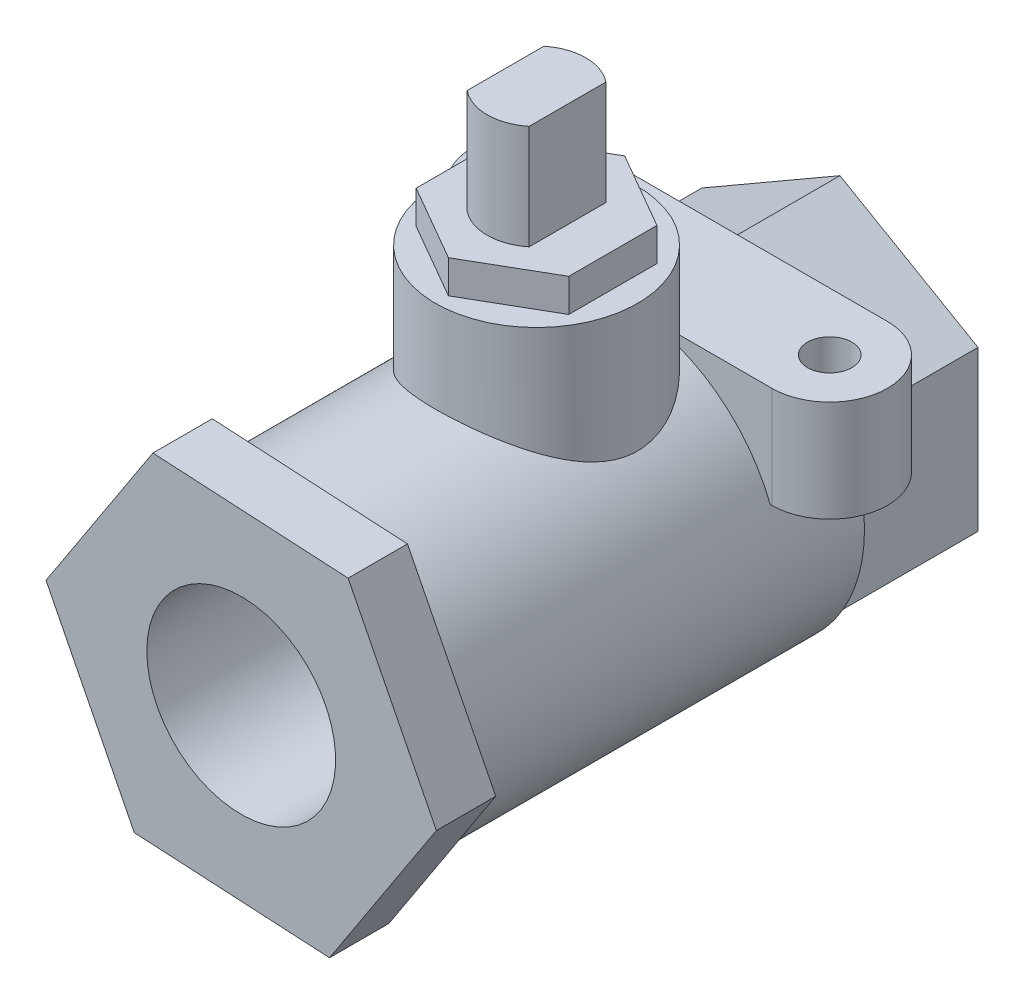
from build123d import *

# Parameters (mm, degrees)
SKETCH1_R                = 15.0114
BOSS_EXTRUDE1_DEPTH      = 38.1
BOSS_EXTRUDE2_DEPTH      = 5.588
BOSS_EXTRUDE3_DEPTH      = 12.7
BOSS_EXTRUDE4_DEPTH      = 9.5504
SKETCH4_R                = 8.89
CUT_EXTRUDE1_DEPTH       = 62.91098247
BOSS_EXTRUDE5_DEPTH      = 8.636
BOSS_EXTRUDE5_DEPTH_BACK = 5.08
SKETCH6_R                = 9.525
BOSS_EXTRUDE6_DEPTH      = 3.1115
BOSS_EXTRUDE7_DEPTH      = 9.8298
SKETCH9_R                = 2.08915
CUT_EXTRUDE2_DEPTH       = 8.89


with BuildPart() as part:
    # Sketch1 → Boss-Extrude1 (new body)
    with BuildSketch(Plane.XY):
        Circle(SKETCH1_R)
    extrude(amount=BOSS_EXTRUDE1_DEPTH)

    # Sketch2 → Boss-Extrude2 (add)
    with BuildSketch(Plane.XY.offset(38.1)):
        Polygon((-8.314485622, 16.42722286), (-18.383635121, 1.013055662), (-10.069149499, -15.414167198), (8.314485622, -16.42722286), (18.383635121, -1.013055662), (10.069149499, 15.414167198), align=None)
    extrude(amount=BOSS_EXTRUDE2_DEPTH)

    # Sketch3 → Boss-Extrude3 (add)
    with BuildSketch(Plane(origin=(0, 0, 0), x_dir=(-1, 0, 0), z_dir=(0, 0, -1))):
        Polygon((0, 15.0114), (-13.000253746, 7.5057), (-13.000253746, -7.5057), (0, -15.0114), (13.000253746, -7.5057), (13.000253746, 7.5057), align=None)
    extrude(amount=BOSS_EXTRUDE3_DEPTH)

    # Sketch5 → Boss-Extrude4 (add)
    with BuildSketch(Plane(origin=(0, 15.0114, 0), x_dir=(1, 0, 0), z_dir=(0, 1, 0))):
        with BuildLine():
            Line((-14.1351, 3.048), (14.1351, 3.048))
            ThreePointArc((14.1351, 3.048), (19.5834, -2.4003), (14.1351, -7.8486))
            Line((14.1351, -7.8486), (-14.1351, -7.8486))
            ThreePointArc((-14.1351, -7.8486), (-19.5834, -2.4003), (-14.1351, 3.048))
        make_face()
    extrude(amount=-BOSS_EXTRUDE4_DEPTH)

    # Sketch4 → Cut-Extrude1 (cut, through all)
    with BuildSketch(Plane(origin=(0, 0, -12.7), x_dir=(-1, 0, 0), z_dir=(0, 0, -1))):
        Circle(SKETCH4_R)
    extrude(amount=-CUT_EXTRUDE1_DEPTH, mode=Mode.SUBTRACT)

    # Sketch6 → Boss-Extrude5 (add, two sides: drawn at the far end of the back side and taken through both)
    with BuildSketch(Plane(origin=(0, 15.0114, 0), x_dir=(1, 0, 0), z_dir=(0, 1, 0)).offset(-BOSS_EXTRUDE5_DEPTH_BACK)):
        with Locations((0, -15.875)):
            Circle(SKETCH6_R)
    extrude(amount=BOSS_EXTRUDE5_DEPTH + BOSS_EXTRUDE5_DEPTH_BACK)

    # Sketch7 → Boss-Extrude6 (add)
    with BuildSketch(Plane(origin=(0, 23.6474, 0), x_dir=(1, 0, 0), z_dir=(0, 1, 0))):
        Polygon((0, -7.57478159), (-7.1882, -11.724890795), (-7.1882, -20.025109205), (0, -24.17521841), (7.1882, -20.025109205), (7.1882, -11.724890795), align=None)
    extrude(amount=BOSS_EXTRUDE6_DEPTH)

    # Sketch8 → Boss-Extrude7 (add)
    with BuildSketch(Plane(origin=(0, 26.7589, 0), x_dir=(1, 0, 0), z_dir=(0, 1, 0))):
        with BuildLine():
            Line((-2.921, -12.259267399), (-2.921, -19.490732601))
            ThreePointArc((-2.921, -19.490732601), (0, -20.5232), (2.921, -19.490732601))
            Line((2.921, -19.490732601), (2.921, -12.259267399))
            ThreePointArc((2.921, -12.259267399), (0, -11.2268), (-2.921, -12.259267399))
        make_face()
    extrude(amount=BOSS_EXTRUDE7_DEPTH)

    # Sketch9 → Cut-Extrude2 (cut)
    with BuildSketch(Plane(origin=(0, 15.0114, 0), x_dir=(1, 0, 0), z_dir=(0, 1, 0))):
        with Locations((-14.1351, -2.4003)):
            Circle(SKETCH9_R)
        with Locations((14.1351, -2.4003)):
            Circle(SKETCH9_R)
    extrude(amount=-CUT_EXTRUDE2_DEPTH, mode=Mode.SUBTRACT)


solid = part.part
